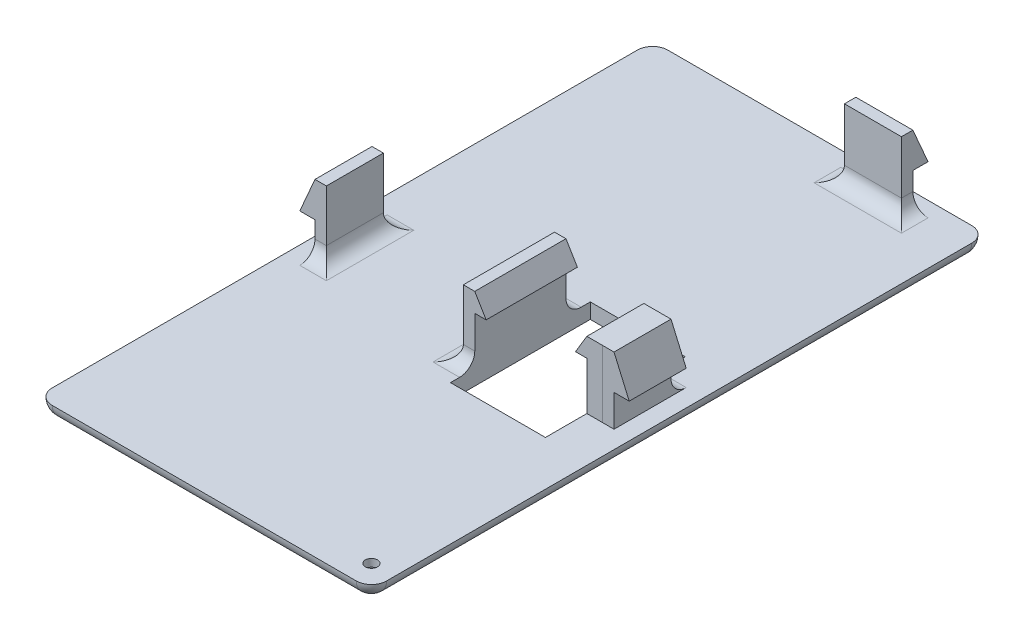
from build123d import *

# Parameters (mm, degrees)
SKETCH_1_W          = 44
SKETCH_1_H          = 81
EXTRUDE_1_DEPTH     = 2
FILLET_1_R          = 2
SKETCH_4_W          = 1.5
SKETCH_4_H          = 7.5
EXTRUDE_4_DEPTH     = 8.8
EXTRUDE_5_DEPTH     = 7.5
SKETCH_7_R          = 0.8
CUT_EXTRUDE_1_DEPTH = 8.8
SKETCH_8_R          = 2
CUT_EXTRUDE_2_DEPTH = 1
SKETCH_10_W         = 7.5
SKETCH_10_H         = 1.5
EXTRUDE_6_DEPTH     = 9
EXTRUDE_7_DEPTH     = 7.5
SKETCH_12_W         = 12.5
SKETCH_12_H         = 18.4
CUT_EXTRUDE_3_DEPTH = 7.5
SKETCH_13_W         = 2.075122626
SKETCH_13_H         = 7.498383059
EXTRUDE_8_DEPTH     = 8.8
EXTRUDE_9_DEPTH     = 7.5
SKETCH_15_W         = 1.5
SKETCH_15_H         = 12
EXTRUDE_10_DEPTH    = 8.8
EXTRUDE_11_DEPTH    = 12
FILLET_2_R          = 2


with BuildPart() as part:
    # 草图1 → 凸台-拉伸1 (new body)
    with BuildSketch(Plane(origin=(0, 0, 0), x_dir=(1, 0, 0), z_dir=(0, 1, 0))):
        with Locations((0, 2.5)):
            Rectangle(SKETCH_1_W, SKETCH_1_H)
    extrude(amount=EXTRUDE_1_DEPTH)

    # 圆角1
    fillet_1_edges = [part.edges().sort_by_distance(p)[0] for p in [
        (0, 0, -43),
        (22, 0, -2.5),
        (0, 0, 38),
        (-22, 0, -2.5),
        (-22, 1, -43),
        (22, 1, -43),
        (22, 1, 38),
        (-22, 1, 38),
    ]]
    fillet(fillet_1_edges, radius=FILLET_1_R - 0.0001)  # a hair under: the kernel refuses the full size

    # 草图4 → 凸台-拉伸4 (add)
    with BuildSketch(Plane(origin=(0, 2, 0), x_dir=(1, 0, 0), z_dir=(0, 1, 0))):
        with Locations((-18.924971335, 0)):
            Rectangle(SKETCH_4_W, SKETCH_4_H)
    extrude_4 = extrude(amount=EXTRUDE_4_DEPTH)

    # 草图6 → 凸台-拉伸5 (add)
    with BuildSketch(Plane.XY.offset(3.75)):
        Polygon((-19.674971335, 10.8), (-21.674971335, 6.2), (-19.674971335, 6.2), align=None)
    extrude_5 = extrude(amount=-EXTRUDE_5_DEPTH)

    # 镜向2: 凸台-拉伸4, 凸台-拉伸5 across plane
    add(extrude_4.mirror(Plane(origin=(0, 0, 0), x_dir=(0, 0, 1), z_dir=(1, 0, 0))))
    add(extrude_5.mirror(Plane(origin=(0, 0, 0), x_dir=(0, 0, 1), z_dir=(1, 0, 0))))

    # 草图7 → 切除-拉伸1 (cut)
    with BuildSketch(Plane.XZ):
        with Locations(Location((19, 35, 0), (0, 0, 270))):
            Circle(SKETCH_7_R)
    extrude(amount=-CUT_EXTRUDE_1_DEPTH, mode=Mode.SUBTRACT)

    # 草图8 → 切除-拉伸2 (cut)
    with BuildSketch(Plane.XZ):
        with Locations(Location((19, 35, 0), (0, 0, 270))):
            Circle(SKETCH_8_R)
    extrude(amount=-CUT_EXTRUDE_2_DEPTH, mode=Mode.SUBTRACT)

    # 草图10 → 凸台-拉伸6 (add)
    with BuildSketch(Plane(origin=(0, 2, 0), x_dir=(1, 0, 0), z_dir=(0, 1, 0))):
        with Locations((10.5, 40.25)):
            Rectangle(SKETCH_10_W, SKETCH_10_H)
    extrude(amount=EXTRUDE_6_DEPTH)

    # 草图11 → 凸台-拉伸7 (add)
    with BuildSketch(Plane(origin=(14.25, 0, 0), x_dir=(0, 0, -1), z_dir=(1, 0, 0))):
        Polygon((41, 11), (43, 6.4), (41, 6.4), align=None)
    extrude(amount=-EXTRUDE_7_DEPTH)

    # 草图12 → 切除-拉伸3 (cut)
    with BuildSketch(Plane.XZ):
        with Locations((9.849848709, 0)):
            Rectangle(SKETCH_12_W, SKETCH_12_H)
    extrude(amount=-CUT_EXTRUDE_3_DEPTH, mode=Mode.SUBTRACT)

    # 草图13 → 凸台-拉伸8 (add)
    with BuildSketch(Plane(origin=(0, 2, 0), x_dir=(1, 0, 0), z_dir=(0, 1, 0))):
        with Locations((17.137410022, 0.000808471)):
            Rectangle(SKETCH_13_W, SKETCH_13_H)
    extrude(amount=EXTRUDE_8_DEPTH)

    # 草图14 → 凸台-拉伸9 (add)
    with BuildSketch(Plane.XY.offset(3.748383059)):
        Polygon((16.099848709, 10.8), (14.599848709, 8.3), (16.099848709, 8.3), align=None)
    extrude(amount=-EXTRUDE_9_DEPTH)

    # 草图15 → 凸台-拉伸10 (add)
    with BuildSketch(Plane(origin=(0, 2, 0), x_dir=(1, 0, 0), z_dir=(0, 1, 0))):
        with Locations((2.849848709, 0)):
            Rectangle(SKETCH_15_W, SKETCH_15_H)
    extrude(amount=EXTRUDE_10_DEPTH)

    # 草图16 → 凸台-拉伸11 (add)
    with BuildSketch(Plane.XY.offset(6)):
        Polygon((3.599848709, 10.8), (5.099848709, 8.3), (3.599848709, 8.3), align=None)
    extrude(amount=-EXTRUDE_11_DEPTH)

    # 圆角2
    fillet_2_edges = [part.edges().sort_by_distance(p)[0] for p in [
        (6.75, 2, -40.25),
        (10.5, 2, -39.5),
        (14.25, 2, -40.25),
        (2.849848709, 2, -6),
        (2.099848709, 2, 0),
        (2.849848709, 2, 6),
        (-18.924971335, 2, 3.75),
        (-18.174971335, 2, 0),
        (-18.924971335, 2, -3.75),
        (17.887410022, 2, -3.75),
    ]]
    fillet(fillet_2_edges, radius=FILLET_2_R)


solid = part.part
